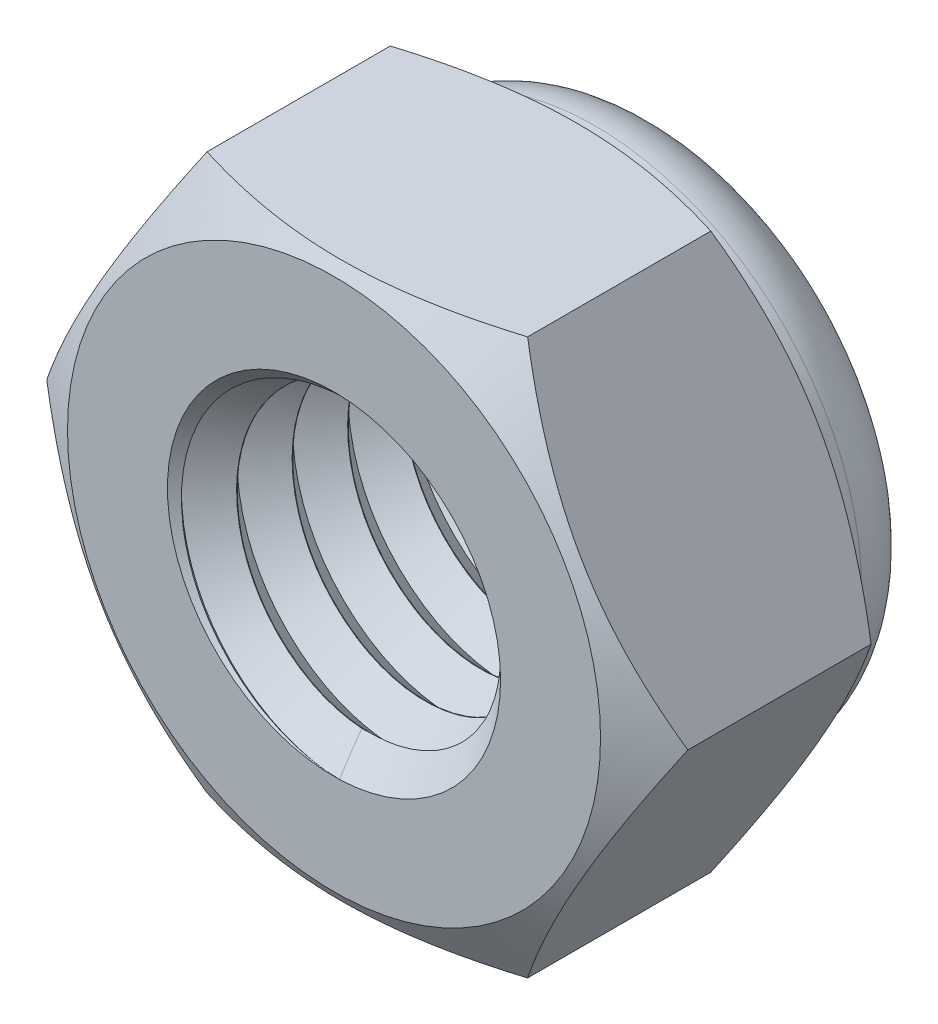
from build123d import *

# Parameters (mm, degrees)
ESBO_O1_R                 = 2.5
RESSALTO_EXTRUS_O1_DEPTH  = 4.5
CHANFRO1_SIZE             = 0.5
VARREDURA_DE_CORTE1_PITCH = 1


with BuildPart() as part:
    # Esboço1 → Ressalto-extrusão1 (new body)
    with BuildSketch(Plane.XY):
        Polygon((5.773502692, 0), (2.886751346, 5), (-2.886751346, 5), (-5.773502692, 0), (-2.886751346, -5), (2.886751346, -5), align=None)
        Circle(ESBO_O1_R, mode=Mode.SUBTRACT)
    extrude(amount=RESSALTO_EXTRUS_O1_DEPTH)

    # Chanfro1
    chanfro1_edges = [part.edges().sort_by_distance(p)[0] for p in [
        (-2.5, 0, 4.5),
    ]]
    chamfer(chanfro1_edges, length=CHANFRO1_SIZE)

    # Esboço2 → Revolução1 (revolve)
    with BuildSketch(Plane(origin=(0, 0, 0), x_dir=(1, 0, 0), z_dir=(0, 1, 0)), mode=Mode.PRIVATE) as revolu_o1_sk:
        with BuildLine():
            Line((-4.8, 0), (-4.8, 0.2))
            ThreePointArc((-4.8, 0.2), (-4.419238816, 1.119238816), (-3.5, 1.5))
            Line((-3.5, 1.5), (-3.1, 1.5))
            Line((-3.1, 1.5), (-3.1, 1.3))
            Line((-3.1, 1.3), (-3.5, 1.3))
            ThreePointArc((-3.5, 1.3), (-4.277817459, 0.977817459), (-4.6, 0.2))
            Line((-4.6, 0.2), (-4.6, 0))
            Line((-4.6, 0), (-4.8, 0))
        make_face()
    revolve(revolu_o1_sk.sketch.rotate(Axis((0, 0, 0), (0, 0, -1)), 180), axis=Axis((0, 0, 0), (0, 0, -1)))

    # Esboço4 → Corte-Revolução1 (revolve, cut)
    with BuildSketch(Plane(origin=(0, 0, 0), x_dir=(1, 0, 0), z_dir=(0, 1, 0))):
        Polygon((4.8, 0), (5.773502692, 0), (5.773502692, -0.6), align=None)
        Polygon((4.8, -4.5), (5.773502692, -4.5), (5.773502692, -3.9), align=None)
    revolve(axis=Axis((0, 0, 0), (0, 0, 1)), mode=Mode.SUBTRACT)


with BuildPart() as body_2:
    # Esboço3 → Revolução2 (revolve)
    with BuildSketch(Plane(origin=(0, 0, 0), x_dir=(1, 0, 0), z_dir=(0, 1, 0)), mode=Mode.PRIVATE) as revolu_o2_sk:
        with BuildLine():
            Line((-3.5, 1.28), (-2.5, 1.28))
            Line((-2.5, 1.28), (-2.5, 0.02))
            Line((-2.5, 0.02), (-4.58, 0.02))
            Line((-4.58, 0.02), (-4.58, 0.2))
            ThreePointArc((-4.58, 0.2), (-4.263675324, 0.963675324), (-3.5, 1.28))
        make_face()
    revolve(revolu_o2_sk.sketch.rotate(Axis((0, 0, 0), (0, 0, -1)), 180), axis=Axis((0, 0, 0), (0, 0, -1)))


with BuildPart() as varredura_de_corte1_tool:
    # Varredura de corte1: the profile of Esboço6 profile screwed along a right-hand helix of 8 turns, 8 arcs to a turn; built about Z, then put on its axis
    varredura_de_corte1_z = Axis((0, 0, 0), (0, 0, 1))
    varredura_de_corte1_corners = [(2.4997, 0, 0.000297), (2.4997, 0, -0.990297), (3, 0, -0.495)]
    with BuildLine(mode=Mode.PRIVATE) as varredura_de_corte1_profile:
        Line(varredura_de_corte1_corners[0], varredura_de_corte1_corners[1])
        Line(varredura_de_corte1_corners[1], varredura_de_corte1_corners[2])
        Line(varredura_de_corte1_corners[2], varredura_de_corte1_corners[0])
    varredura_de_corte1_cap = Face(varredura_de_corte1_profile.wire())
    varredura_de_corte1_turn_angles = [0, 22.5, 45, 67.5, 90, 112.5, 135, 157.5, 180, 202.5, 225, 247.5, 270, 292.5, 315, 337.5, 360]
    varredura_de_corte1_turn_weights = [1, 0.9238795325112867, 1, 0.9238795325112867, 1, 0.9238795325112867, 1, 0.9238795325112867, 1, 0.9238795325112867, 1, 0.9238795325112867, 1, 0.9238795325112867, 1, 0.9238795325112867, 1]
    varredura_de_corte1_turn_rails = [Edge.make_bspline([Vector(p[0], p[1], 0).rotate(varredura_de_corte1_z, varredura_de_corte1_turn_angles[k]) / varredura_de_corte1_turn_weights[k] + Vector(0, 0, p[2] + VARREDURA_DE_CORTE1_PITCH * varredura_de_corte1_turn_angles[k] / 360) for k in range(17)], [0, 0, 0, 1, 1, 2, 2, 3, 3, 4, 4, 5, 5, 6, 6, 7, 7, 8, 8, 8], 2, varredura_de_corte1_turn_weights) for p in varredura_de_corte1_corners]
    varredura_de_corte1_turn_sides = [Face.make_surface_from_curves(varredura_de_corte1_turn_rails[p[0]], varredura_de_corte1_turn_rails[p[1]]) for p in [(0, 1), (1, 2), (2, 0)]]
    varredura_de_corte1 = Plane(origin=(0, 0, 4.5), x_dir=(0, 1, 0), z_dir=(0, 0, -1)) * Solid(Shell([*[p.moved(Location((0, 0, VARREDURA_DE_CORTE1_PITCH * i))) for i in range(8) for p in varredura_de_corte1_turn_sides], varredura_de_corte1_cap, varredura_de_corte1_cap.rotate(varredura_de_corte1_z, 2880).moved(Location((0, 0, VARREDURA_DE_CORTE1_PITCH * 2880 / 360)))]))
    add(varredura_de_corte1)


with BuildPart() as part_1:
    add(part.part)

    # Varredura de corte1: cut by varredura_de_corte1_tool
    add(varredura_de_corte1_tool.part, mode=Mode.SUBTRACT)


with BuildPart() as body_2_1:
    add(body_2.part)

    # Varredura de corte1: cut by varredura_de_corte1_tool
    add(varredura_de_corte1_tool.part, mode=Mode.SUBTRACT)


solid = Compound([part_1.part, body_2_1.part])
